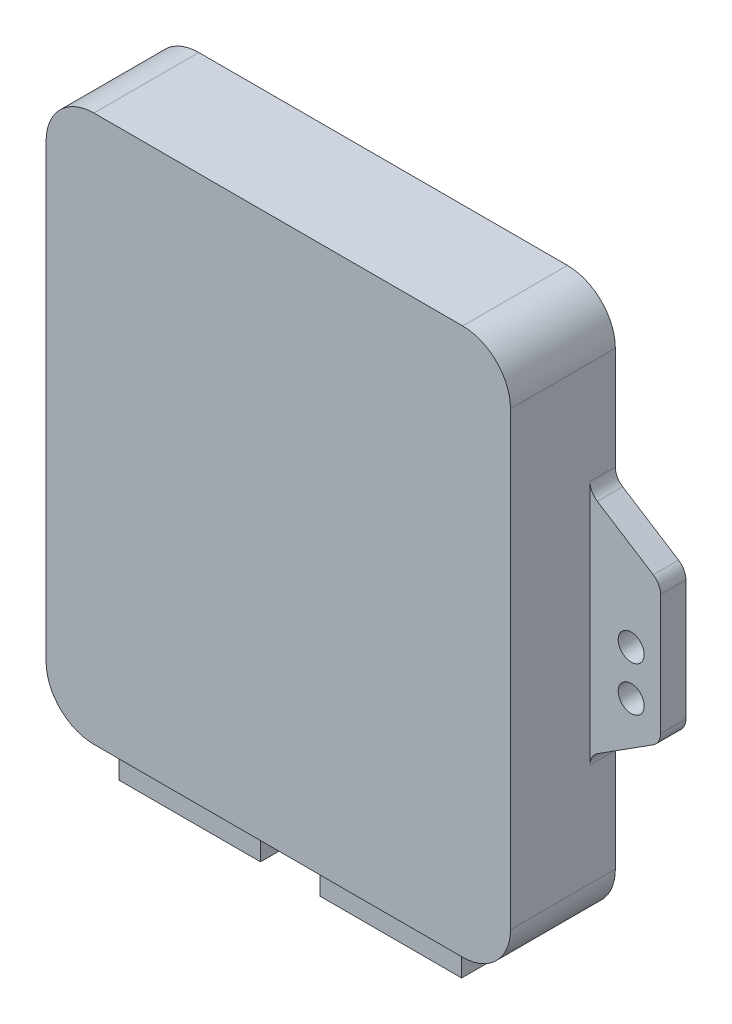
from build123d import *

# Parameters (mm, degrees)
SKETCH1_W                    = 58.25
SKETCH1_H                    = 68.58
BOSS_EXTRUDE1_DEPTH          = 6.575
FILLET1_R                    = 6
BOSS_EXTRUDE2_DEPTH          = 3.175
SKETCH6_W                    = 17.78
SKETCH6_H                    = 5.08
BOSS_EXTRUDE3_DEPTH          = 3.81
F_30_0_1285_DIAMETER_HOLE1_D = 3.2639
FILLET2_R                    = 2
CUT_EXTRUDE1_DEPTH           = 55.710248126


with BuildPart() as part:
    # Sketch1 → Boss-Extrude1 (new, symmetric)
    with BuildSketch(Plane.XY):
        Rectangle(SKETCH1_W, SKETCH1_H)
    extrude(amount=BOSS_EXTRUDE1_DEPTH, both=True)

    # Fillet1
    fillet1_edges = [part.edges().sort_by_distance(p)[0] for p in [
        (29.125, -34.29, 0),
        (-29.125, -34.29, 0),
        (29.125, 34.29, 0),
        (-29.125, 34.29, 0),
    ]]
    fillet(fillet1_edges, radius=FILLET1_R)

    # Sketch2 → Boss-Extrude2 (add)
    with BuildSketch(Plane(origin=(0, 0, -6.575), x_dir=(-1, 0, 0), z_dir=(0, 0, -1))):
        Polygon((-29.125, 14.29), (-37.975, 8.65), (-37.975, -8.65), (-29.125, -14.29), align=None)
    boss_extrude2 = extrude(amount=-BOSS_EXTRUDE2_DEPTH)

    # Sketch6 → Boss-Extrude3 (add)
    with BuildSketch(Plane.XZ.offset(34.29)):
        with Locations((-12.615, 2.54)):
            Rectangle(SKETCH6_W, SKETCH6_H)
    boss_extrude3 = extrude(amount=BOSS_EXTRUDE3_DEPTH)

    # #30 (0.1285) Diameter Hole1 (through all)
    with Locations(Plane.XY.offset(-3.4)):
        with Locations((34.29, 0), (34.29, -5.588)):
            f_30_0_1285_diameter_hole1 = Hole(F_30_0_1285_DIAMETER_HOLE1_D / 2)

    # Mirror1: Boss-Extrude2, Boss-Extrude3, #30 (0.1285) Diameter Hole1 across plane
    add(boss_extrude2.mirror(Plane(origin=(0, 0, 0), x_dir=(0, 0, 1), z_dir=(1, 0, 0))))
    add(boss_extrude3.mirror(Plane(origin=(0, 0, 0), x_dir=(0, 0, 1), z_dir=(1, 0, 0))))
    add(f_30_0_1285_diameter_hole1.mirror(Plane(origin=(0, 0, 0), x_dir=(0, 0, 1), z_dir=(1, 0, 0))), mode=Mode.SUBTRACT)

    # Fillet2
    fillet2_edges = [part.edges().sort_by_distance(p)[0] for p in [
        (29.125, 14.29, -4.9875),
        (37.975, 8.65, -4.9875),
        (37.975, -8.65, -4.9875),
        (29.125, -14.29, -4.9875),
        (-29.125, -14.29, -4.9875),
        (-37.975, -8.65, -4.9875),
        (-37.975, 8.65, -4.9875),
        (-29.125, 14.29, -4.9875),
    ]]
    fillet(fillet2_edges, radius=FILLET2_R)

    # Sketch5 → Cut-Extrude1 (cut, through all)
    with BuildSketch(Plane.XY.offset(-3.4)):
        with BuildLine():
            Line((-33.6169, -7.20725), (-34.9631, -7.20725))
            ThreePointArc((-34.9631, -7.20725), (-36.58235, -5.588), (-34.9631, -3.96875))
            Line((-34.9631, -3.96875), (-33.6169, -3.96875))
            ThreePointArc((-33.6169, -3.96875), (-31.99765, -5.588), (-33.6169, -7.20725))
        make_face()
    extrude(amount=-CUT_EXTRUDE1_DEPTH, mode=Mode.SUBTRACT)


solid = part.part
